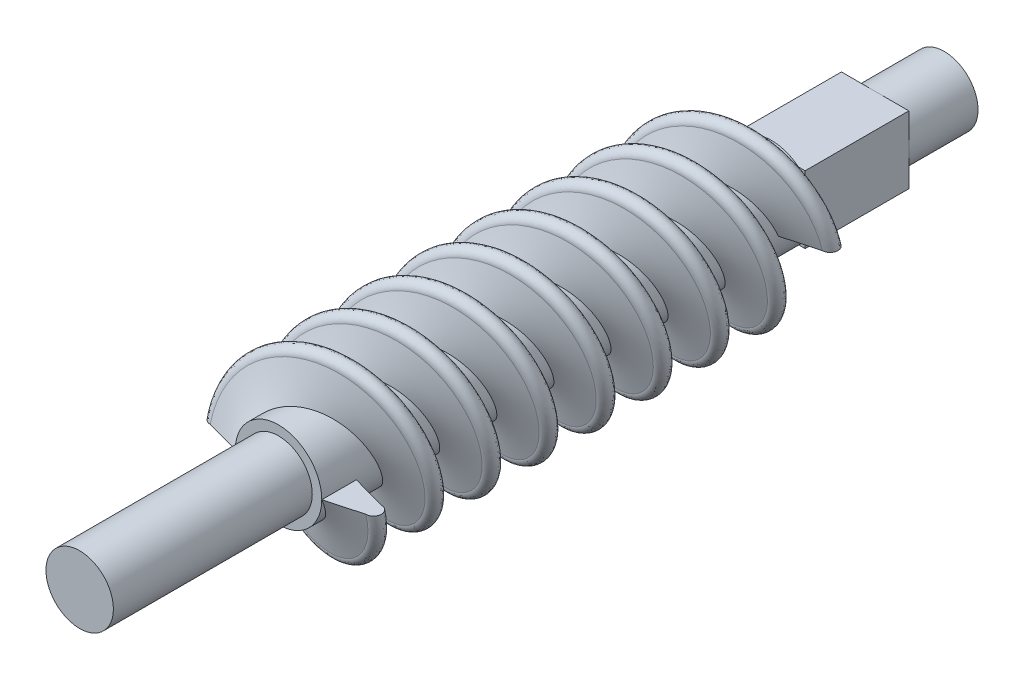
from build123d import *
from build123d.topology import SkipClean

# Parameters (mm, degrees)
ESQUISSE1_R         = 5
BOSS_EXTRU_1_DEPTH  = 55
BALAYAGE2_PITCH     = 13.2
BALAYAGE2_HEIGHT    = 52.8
BALAYAGE2_RADIUS    = 5
CIRPATTERN1_COUNT   = 2
SKETCH1_R           = 3.9
BEARING_SIDE_DEPTH  = 25
SKETCH2_R           = 5
BOSS_EXTRUDE2_DEPTH = 2
ARBRE_W             = 7.8
ARBRE_H             = 7.8
BOSS_EXTRUDE3_DEPTH = 12
BOSS_EXTRUDE4_START = 8
SKETCH4_R           = 3.9
BOSS_EXTRUDE4_DEPTH = 8


with BuildPart() as part:
    # Esquisse1 → Boss.-Extru.1 (new body)
    with BuildSketch(Plane.XY):
        Circle(ESQUISSE1_R)
    extrude(amount=BOSS_EXTRU_1_DEPTH)

    # Balayage2: sweep along a helix
    with BuildLine() as balayage2_path:
        Helix(BALAYAGE2_PITCH, BALAYAGE2_HEIGHT, BALAYAGE2_RADIUS, center=(0, 0, 55), direction=(0, 0, -1))
    # Esquisse4 → Balayage2 (sweep)
    with BuildSketch(Plane(origin=(0, 0, 0), x_dir=(1, 0, 0), z_dir=(0, 1, 0))):
        with BuildLine():
            Line((-9, -54.1), (-5, -53))
            Line((-5, -53), (-4.702014603, -53))
            Line((-4.702014603, -53), (-4.702014603, -57))
            Line((-4.702014603, -57), (-5, -57))
            Line((-5, -57), (-9, -55.9))
            ThreePointArc((-9, -55.9), (-9.9, -55), (-9, -54.1))
        make_face()
    balayage2 = sweep(path=balayage2_path.line, is_frenet=True)

    # CirPattern1: Balayage2 ×2 about axis
    cirpattern1_axis = Axis((0, 0, 55), (0, 0, -1))
    for i in range(1, CIRPATTERN1_COUNT):
        add(balayage2.rotate(cirpattern1_axis, i * 360 / CIRPATTERN1_COUNT))

    # Sketch1 → Bearing-side (add)
    with BuildSketch(Plane.XY.offset(55)):
        Circle(SKETCH1_R)
    extrude(amount=BEARING_SIDE_DEPTH)

    # Sketch2 → Boss-Extrude2 (add)
    with SkipClean():  # the faces are left unmerged after this step: merging them gives an invalid solid
        with BuildSketch(Plane.XY.offset(55)):
            Circle(SKETCH2_R)
        extrude(amount=BOSS_EXTRUDE2_DEPTH)

    # arbre → Boss-Extrude3 (add)
    with BuildSketch(Plane(origin=(0, 0, 0), x_dir=(-1, 0, 0), z_dir=(0, 0, -1))):
        Rectangle(ARBRE_W, ARBRE_H)
    extrude(amount=BOSS_EXTRUDE3_DEPTH)

    # Sketch4 → Boss-Extrude4 (add)
    with SkipClean():  # the faces are left unmerged after this step: merging them gives an invalid solid
        with BuildSketch(Plane(origin=(0, 0, -12), x_dir=(-1, 0, 0), z_dir=(0, 0, -1)).offset(BOSS_EXTRUDE4_START)):
            with Locations(Location((0, 0, 0), (0, 0, 180))):
                Circle(SKETCH4_R)
        extrude(amount=-BOSS_EXTRUDE4_DEPTH)


solid = part.part
